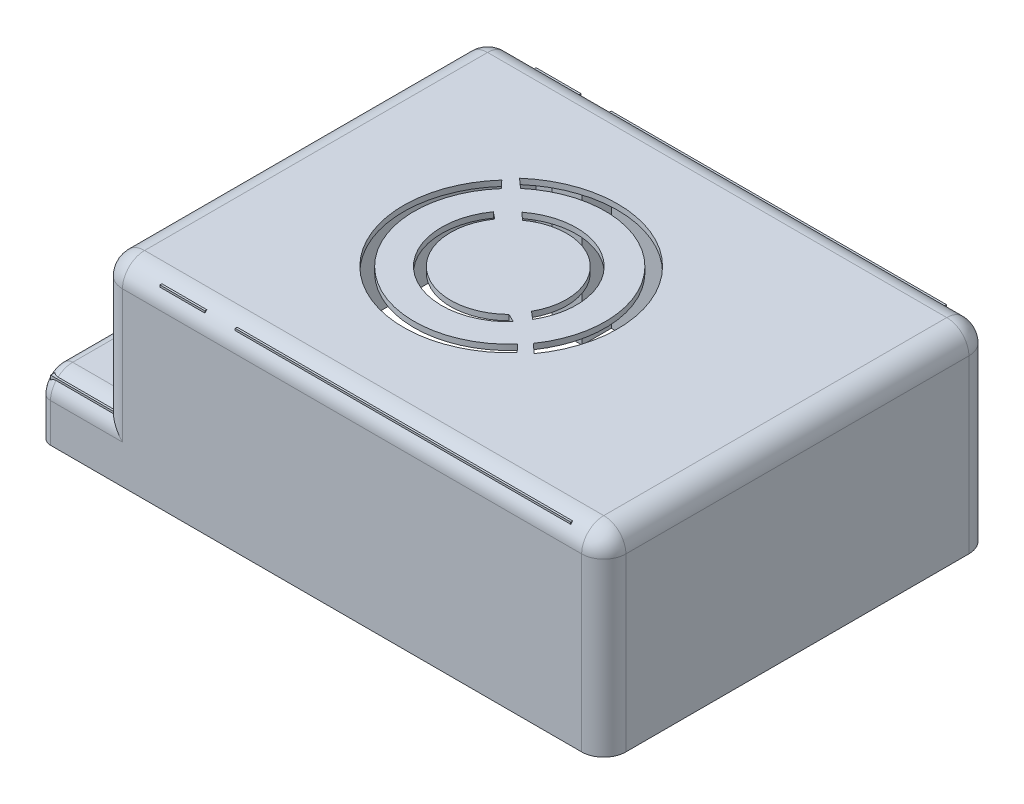
from build123d import *

# Parameters (mm, degrees)
SKETCH1_W                                         = 102
SKETCH1_H                                         = 70
BOSS_EXTRUDE3_DEPTH                               = 35
SKETCH4_W                                         = 11
SKETCH4_H                                         = 70
CUT_EXTRUDE1_DEPTH                                = 129.565158577
SKETCH5_W                                         = 11
SKETCH5_H                                         = 70
BOSS_EXTRUDE4_DEPTH                               = 11
SKETCH6_W                                         = 19.77432328
SKETCH6_H                                         = 68
CUT_EXTRUDE2_DEPTH                                = 10
SKETCH7_W                                         = 79.638593358
SKETCH7_H                                         = 68
CUT_EXTRUDE3_DEPTH                                = 34
CUT_EXTRUDE4_DEPTH                                = 127.210142223
CUT_EXTRUDE4_DEPTH_BACK                           = 127.210142223
SKETCH8_R                                         = 3
BOSS_EXTRUDE6_REACH                               = 130.565
SKETCH9_W                                         = 5.385848538
SKETCH9_H                                         = 5.939128552
SKETCH9_W_2                                       = 5.471564249
SKETCH9_W_3                                       = 5.47184949
SKETCH9_H_2                                       = 5.281988132
BOSS_EXTRUDE7_REACH                               = 130.565
SKETCH10_R                                        = 3
SKETCH11_R                                        = 3
CUT_EXTRUDE5_DEPTH                                = 31
CSK_FOR_0_FLAT_HEAD_MACHINE_SCREW_100_D           = 1.778
CSK_FOR_0_FLAT_HEAD_MACHINE_SCREW_100_DEPTH       = 15
CSK_FOR_0_FLAT_HEAD_MACHINE_SCREW_100_CSINK_D     = 3.0226
CSK_FOR_0_FLAT_HEAD_MACHINE_SCREW_100_CSINK_ANGLE = 100
CSK_FOR_0_FLAT_HEAD_MACHINE_SCREW_100_TIP         = 0.53416509
CSK_FOR_M2_FLAT_HEAD_MACHINE_SCREW2_D             = 2.4
CSK_FOR_M2_FLAT_HEAD_MACHINE_SCREW2_DEPTH         = 3.2
CSK_FOR_M2_FLAT_HEAD_MACHINE_SCREW2_CSINK_D       = 4.4
CSK_FOR_M2_FLAT_HEAD_MACHINE_SCREW2_CSINK_ANGLE   = 90
CSK_FOR_M2_FLAT_HEAD_MACHINE_SCREW2_TIP           = 0.721032743
CUT_EXTRUDE6_DEPTH                                = 129.565158577
FILLET4_R                                         = 4
FILLET5_R                                         = 2
FILLET6_R                                         = 1
FILLET8_R                                         = 1


with BuildPart() as part:
    # Sketch1 → Boss-Extrude3 (new body)
    with BuildSketch(Plane(origin=(0, 0, 0), x_dir=(1, 0, 0), z_dir=(0, 1, 0))):
        with Locations((51, 35)):
            Rectangle(SKETCH1_W, SKETCH1_H)
    extrude(amount=BOSS_EXTRUDE3_DEPTH)

    # Sketch4 → Cut-Extrude1 (cut, through all)
    with BuildSketch(Plane(origin=(0, 0, 0), x_dir=(1, 0, 0), z_dir=(0, 1, 0))):
        with Locations((5.5, 35)):
            Rectangle(SKETCH4_W, SKETCH4_H)
    extrude(amount=CUT_EXTRUDE1_DEPTH, mode=Mode.SUBTRACT)

    # Sketch5 → Boss-Extrude4 (add)
    with BuildSketch(Plane(origin=(0, 0, 0), x_dir=(1, 0, 0), z_dir=(0, 1, 0))):
        with Locations((5.5, 35)):
            Rectangle(SKETCH5_W, SKETCH5_H)
    extrude(amount=BOSS_EXTRUDE4_DEPTH)

    # Sketch6 → Cut-Extrude2 (cut)
    with BuildSketch(Plane(origin=(0, 0, 0), x_dir=(1, 0, 0), z_dir=(0, 1, 0))):
        with Locations((10.88716164, 35)):
            Rectangle(SKETCH6_W, SKETCH6_H)
    extrude(amount=CUT_EXTRUDE2_DEPTH, mode=Mode.SUBTRACT)

    # Sketch7 → Cut-Extrude3 (cut)
    with BuildSketch(Plane(origin=(0, 0, 0), x_dir=(1, 0, 0), z_dir=(0, 1, 0))):
        with Locations((60.593619959, 35)):
            Rectangle(SKETCH7_W, SKETCH7_H)
    extrude(amount=CUT_EXTRUDE3_DEPTH, mode=Mode.SUBTRACT)

    # Sketch8 → Cut-Extrude4 (cut, two sides: drawn at the far end of the back side and taken through both)
    with BuildSketch(Plane(origin=(0, 10, 0), x_dir=(-1, 0, 0), z_dir=(0, -1, 0)).offset(-CUT_EXTRUDE4_DEPTH_BACK)):
        with Locations(Location((-6.858, 57, 0), (0, 0, 90))):
            Circle(SKETCH8_R)
        with Locations(Location((-6.858, 43, 0), (0, 0, 90))):
            Circle(SKETCH8_R)
        with Locations(Location((-6.858, 29, 0), (0, 0, 90))):
            Circle(SKETCH8_R)
        with Locations(Location((-6.858, 15, 0), (0, 0, 90))):
            Circle(SKETCH8_R)
    extrude(amount=CUT_EXTRUDE4_DEPTH + CUT_EXTRUDE4_DEPTH_BACK, mode=Mode.SUBTRACT)

    # Sketch9 → Boss-Extrude6 (add, up to next)
    with BuildSketch(Plane(origin=(0, 0, 0), x_dir=(1, 0, 0), z_dir=(0, 1, 0)), mode=Mode.PRIVATE) as boss_extrude6_sk1:
        with Locations((97.719992369, 3.969564276)):
            Rectangle(SKETCH9_W, SKETCH9_H)
    boss_extrude6_tool1 = extrude(boss_extrude6_sk1.sketch, amount=BOSS_EXTRUDE6_REACH, mode=Mode.PRIVATE) - part.part
    # Sketch9 → Boss-Extrude6 (add, up to next)
    with BuildSketch(Plane(origin=(0, 0, 0), x_dir=(1, 0, 0), z_dir=(0, 1, 0)), mode=Mode.PRIVATE) as boss_extrude6_sk2:
        with Locations((31.631525182, 3.969564276)):
            Rectangle(SKETCH9_W_2, SKETCH9_H)
    boss_extrude6_tool2 = extrude(boss_extrude6_sk2.sketch, amount=BOSS_EXTRUDE6_REACH, mode=Mode.PRIVATE) - part.part
    # Sketch9 → Boss-Extrude6 (add, up to next)
    with BuildSketch(Plane(origin=(0, 0, 0), x_dir=(1, 0, 0), z_dir=(0, 1, 0)), mode=Mode.PRIVATE) as boss_extrude6_sk3:
        with Locations((97.676991893, 66.359005934)):
            Rectangle(SKETCH9_W_3, SKETCH9_H_2)
    boss_extrude6_tool3 = extrude(boss_extrude6_sk3.sketch, amount=BOSS_EXTRUDE6_REACH, mode=Mode.PRIVATE) - part.part
    # Sketch9 → Boss-Extrude6 (add, up to next)
    with BuildSketch(Plane(origin=(0, 0, 0), x_dir=(1, 0, 0), z_dir=(0, 1, 0)), mode=Mode.PRIVATE) as boss_extrude6_sk4:
        with Locations((31.631525182, 66.359005934)):
            Rectangle(SKETCH9_W_2, SKETCH9_H_2)
    boss_extrude6_tool4 = extrude(boss_extrude6_sk4.sketch, amount=BOSS_EXTRUDE6_REACH, mode=Mode.PRIVATE) - part.part
    add(boss_extrude6_tool1.solids().sort_by_distance((97.719992, 0, -3.969564))[0])
    add(boss_extrude6_tool2.solids().sort_by_distance((31.631525, 0, -3.969564))[0])
    add(boss_extrude6_tool3.solids().sort_by_distance((97.676992, 0, -66.359006))[0])
    add(boss_extrude6_tool4.solids().sort_by_distance((31.631525, 0, -66.359006))[0])

    # Sketch10 → Boss-Extrude7 (add, up to next)
    with BuildSketch(Plane(origin=(0, 0, 0), x_dir=(1, 0, 0), z_dir=(0, 1, 0)), mode=Mode.PRIVATE) as boss_extrude7_sk1:
        with Locations(Location((70, 54, 0), (0, 0, 270))):
            Circle(SKETCH10_R)
    boss_extrude7_tool1 = extrude(boss_extrude7_sk1.sketch, amount=BOSS_EXTRUDE7_REACH, mode=Mode.PRIVATE) - part.part
    # Sketch10 → Boss-Extrude7 (add, up to next)
    with BuildSketch(Plane(origin=(0, 0, 0), x_dir=(1, 0, 0), z_dir=(0, 1, 0)), mode=Mode.PRIVATE) as boss_extrude7_sk2:
        with Locations(Location((30, 54, 0), (0, 0, 270))):
            Circle(SKETCH10_R)
    boss_extrude7_tool2 = extrude(boss_extrude7_sk2.sketch, amount=BOSS_EXTRUDE7_REACH, mode=Mode.PRIVATE) - part.part
    # Sketch10 → Boss-Extrude7 (add, up to next)
    with BuildSketch(Plane(origin=(0, 0, 0), x_dir=(1, 0, 0), z_dir=(0, 1, 0)), mode=Mode.PRIVATE) as boss_extrude7_sk3:
        with Locations(Location((30, 14, 0), (0, 0, 270))):
            Circle(SKETCH10_R)
    boss_extrude7_tool3 = extrude(boss_extrude7_sk3.sketch, amount=BOSS_EXTRUDE7_REACH, mode=Mode.PRIVATE) - part.part
    # Sketch10 → Boss-Extrude7 (add, up to next)
    with BuildSketch(Plane(origin=(0, 0, 0), x_dir=(1, 0, 0), z_dir=(0, 1, 0)), mode=Mode.PRIVATE) as boss_extrude7_sk4:
        with Locations(Location((70, 14, 0), (0, 0, 270))):
            Circle(SKETCH10_R)
    boss_extrude7_tool4 = extrude(boss_extrude7_sk4.sketch, amount=BOSS_EXTRUDE7_REACH, mode=Mode.PRIVATE) - part.part
    add(boss_extrude7_tool1.solids().sort_by_distance((70, 0, -54))[0])
    add(boss_extrude7_tool2.solids().sort_by_distance((30, 0, -54))[0])
    add(boss_extrude7_tool3.solids().sort_by_distance((30, 0, -14))[0])
    add(boss_extrude7_tool4.solids().sort_by_distance((70, 0, -14))[0])

    # Sketch11 → Cut-Extrude5 (cut)
    with BuildSketch(Plane(origin=(0, 0, 0), x_dir=(1, 0, 0), z_dir=(0, 1, 0))):
        with Locations(Location((70, 14, 0), (0, 0, 270))):
            Circle(SKETCH11_R)
        with Locations(Location((70, 54, 0), (0, 0, 270))):
            Circle(SKETCH11_R)
        with Locations(Location((30, 54, 0), (0, 0, 270))):
            Circle(SKETCH11_R)
        with Locations(Location((30, 14, 0), (0, 0, 270))):
            Circle(SKETCH11_R)
    extrude(amount=CUT_EXTRUDE5_DEPTH, mode=Mode.SUBTRACT)

    # CSK for #0 Flat Head Machine Screw (100)1
    with Locations(Plane(origin=(0, 0, 0), x_dir=(-1, 0, 0), z_dir=(0, -1, 0))):
        with Locations((-98.844719926, 4.029307588), (-96.984944601, 66.662533555), (-31.564019442, 4.029307588), (-31.564019442, 66.310543226)):
            CounterSinkHole(CSK_FOR_0_FLAT_HEAD_MACHINE_SCREW_100_D / 2, CSK_FOR_0_FLAT_HEAD_MACHINE_SCREW_100_CSINK_D / 2, depth=CSK_FOR_0_FLAT_HEAD_MACHINE_SCREW_100_DEPTH, counter_sink_angle=CSK_FOR_0_FLAT_HEAD_MACHINE_SCREW_100_CSINK_ANGLE)
            with Locations((0, 0, -(CSK_FOR_0_FLAT_HEAD_MACHINE_SCREW_100_DEPTH + CSK_FOR_0_FLAT_HEAD_MACHINE_SCREW_100_TIP / 2))):  # 118° drill point
                Cone(0, CSK_FOR_0_FLAT_HEAD_MACHINE_SCREW_100_D / 2, CSK_FOR_0_FLAT_HEAD_MACHINE_SCREW_100_TIP, mode=Mode.SUBTRACT)

    # CSK for M2 Flat Head Machine Screw2
    with Locations(Plane(origin=(0, 31, 0), x_dir=(-1, 0, 0), z_dir=(0, -1, 0))):
        with Locations((-30, 14), (-30, 54), (-70, 54), (-70, 14)):
            CounterSinkHole(CSK_FOR_M2_FLAT_HEAD_MACHINE_SCREW2_D / 2, CSK_FOR_M2_FLAT_HEAD_MACHINE_SCREW2_CSINK_D / 2, depth=CSK_FOR_M2_FLAT_HEAD_MACHINE_SCREW2_DEPTH, counter_sink_angle=CSK_FOR_M2_FLAT_HEAD_MACHINE_SCREW2_CSINK_ANGLE)
            with Locations((0, 0, -(CSK_FOR_M2_FLAT_HEAD_MACHINE_SCREW2_DEPTH + CSK_FOR_M2_FLAT_HEAD_MACHINE_SCREW2_TIP / 2))):  # 118° drill point
                Cone(0, CSK_FOR_M2_FLAT_HEAD_MACHINE_SCREW2_D / 2, CSK_FOR_M2_FLAT_HEAD_MACHINE_SCREW2_TIP, mode=Mode.SUBTRACT)

    # Sketch16 → Cut-Extrude6 (cut, through all)
    with BuildSketch(Plane(origin=(0, 0, 0), x_dir=(1, 0, 0), z_dir=(0, 1, 0))):
        with BuildLine():
            Line((64.669916911, 24.597586994), (66.353051792, 23.072262917))
            ThreePointArc((66.353051792, 23.072262917), (63.617826431, 48.977080465), (37.5700204, 49.20693025))
            Line((37.5700204, 49.20693025), (39.262693262, 47.688972655))
            ThreePointArc((39.262693262, 47.688972655), (62.107967488, 47.30205083), (64.669916911, 24.597586994))
        make_face()
        with BuildLine():
            Line((64.669916911, 21.675638975), (63.360152355, 23.049596958))
            ThreePointArc((63.360152355, 23.049596958), (39.023179634, 21.596437723), (37.5700204, 45.933410444))
            Line((37.5700204, 45.933410444), (36.260255844, 47.307368427))
            ThreePointArc((36.260255844, 47.307368427), (37.649221651, 20.286673167), (64.669916911, 21.675638975))
        make_face()
        with BuildLine():
            Line((60.856667026, 28.280915432), (59.490074673, 29.453747543))
            ThreePointArc((59.490074673, 29.453747543), (57.337120661, 42.211901724), (44.415429176, 42.871900385))
            Line((44.415429176, 42.871900385), (43.117215584, 44.112582115))
            ThreePointArc((43.117215584, 44.112582115), (58.525884099, 43.523662641), (60.856667026, 28.280915432))
        make_face()
        with BuildLine():
            Line((40.447547123, 41.578651509), (41.734771762, 40.564584189))
            ThreePointArc((41.734771762, 40.564584189), (43.617338385, 26.354609494), (57.94005115, 26.926743193))
            Line((57.94005115, 26.926743193), (59.490074673, 26.177158084))
            ThreePointArc((59.490074673, 26.177158084), (42.74836497, 24.950488688), (40.447547123, 41.578651509))
        make_face()
    extrude(amount=CUT_EXTRUDE6_DEPTH, mode=Mode.SUBTRACT)

    # Fillet4
    fillet4_edges = [part.edges().sort_by_distance(p)[0] for p in [
        (102, 35, -35),
        (56.5, 35, 0),
        (56.5, 35, -70),
        (11, 23, 0),
        (11, 23, -70),
        (11, 35, -35),
        (5.5, 11, 0),
        (5.5, 11, -70),
        (102, 17.5, -70),
        (102, 17.5, 0),
    ]]
    fillet(fillet4_edges, radius=FILLET4_R)

    # Fillet5
    fillet5_edges = [part.edges().sort_by_distance(p)[0] for p in [
        (0, 11, -35),
        (0, 3.5, 0),
        (0, 3.5, -70),
        (0, 9.828427125, -68.828427125),
        (0, 9.828427125, -1.171572875),
    ]]
    fillet(fillet5_edges, radius=FILLET5_R)

    # Fillet6
    fillet6_edges = [part.edges().sort_by_distance(p)[0] for p in [
        (6.858, 11, -12),
    ]]
    fillet(fillet6_edges, radius=FILLET6_R - 0.0001)  # a hair under: the kernel refuses the full size

    # Fillet8
    fillet8_edges = [part.edges().sort_by_distance(p)[0] for p in [
        (6.858, 11, -54),
        (6.858, 11, -40),
        (6.858, 11, -26),
    ]]
    fillet(fillet8_edges, radius=FILLET8_R - 0.0001)  # a hair under: the kernel refuses the full size


solid = part.part
